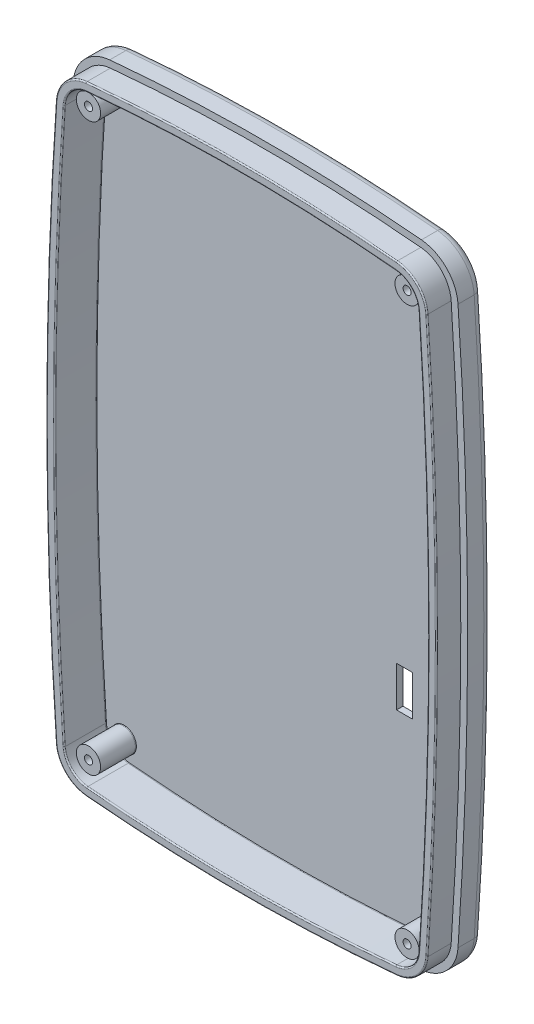
from build123d import *

# Parameters (mm, degrees)
IZIM1_W                           = 50
IZIM1_H                           = 80
Y_KSEKLIK_EKSTR_ZYON1_DEPTH       = 1.5
KES_EKSTR_ZYON1_DEPTH             = 48.265209192
KES_EKSTR_ZYON2_DEPTH             = 48.265209192
RADYUS1_R                         = 5
RADYUS2_R                         = 1
BO_ALTMA1_T                       = -0.7
Y_KSEKLIK_EKSTR_ZYON10_DEPTH      = 3
Y_KSEKLIK_EKSTR_ZYON10_DEPTH_BACK = 2.3
KES_EKSTR_ZYON5_DEPTH             = 3
RADYUS3_R                         = 0.15
Y_KSEKLIK_EKSTR_ZYON18_OUTLINE_W  = 1.361974435
Y_KSEKLIK_EKSTR_ZYON18_OUTLINE_H  = 3.904326714
Y_KSEKLIK_EKSTR_ZYON18_DEPTH      = 0.4
IZIM29_R                          = 1.5
IZIM29_R_2                        = 0.5
Y_KSEKLIK_EKSTR_ZYON19_DEPTH      = 4.5
RADYUS4_R                         = 0.2
Y_KSEKLIK_EKSTR_ZYON20_DEPTH      = 0.1
IZIM31_W                          = 2
IZIM31_H                          = 5
KES_EKSTR_ZYON6_DEPTH             = 10


# Read off the part's stored shape, not the designer's step: Yükseklik-Ekstrüzyon18
with BuildPart() as part:
    # Çizim1 → Yükseklik-Ekstrüzyon1 (new, symmetric)
    with BuildSketch(Plane.XY):
        Rectangle(IZIM1_W, IZIM1_H)
    extrude(amount=Y_KSEKLIK_EKSTR_ZYON1_DEPTH, both=True)

    # Çizim2 → Kes-Ekstrüzyon1 (cut, through all)
    with BuildSketch(Plane.XY.offset(1.5)):
        with BuildLine():
            Line((25, 40), (6.85e-07, 40))
            ThreePointArc((6.85e-07, 40), (12.522480128, 39.624663086), (25, 38.5))
            Line((25, 38.5), (25, 40))
        make_face()
        with BuildLine():
            Line((6.85e-07, 40), (-25, 40))
            Line((-25, 40), (-25, 38.5))
            ThreePointArc((-25, 38.5), (-12.522479444, 39.624663127), (6.85e-07, 40))
        make_face()
        with BuildLine():
            ThreePointArc((6.85e-07, -40), (-12.522479444, -39.624663127), (-25, -38.5))
            Line((-25, -38.5), (-25, -40))
            Line((-25, -40), (6.85e-07, -40))
        make_face()
        with BuildLine():
            Line((25, -40), (25, -38.5))
            ThreePointArc((25, -38.5), (12.522480128, -39.624663086), (6.85e-07, -40))
            Line((6.85e-07, -40), (25, -40))
        make_face()
    extrude(amount=-KES_EKSTR_ZYON1_DEPTH, mode=Mode.SUBTRACT)

    # Çizim3 → Kes-Ekstrüzyon2 (cut, through all)
    with BuildSketch(Plane.XY.offset(1.5)):
        with BuildLine():
            Line((25, 0), (25, 38.5))
            ThreePointArc((25, 38.5), (24.250158144, 38.588932768), (23.5, 38.675156933))
            ThreePointArc((23.5, 38.675156933), (24.624859083, 19.352117221), (25, 0))
        make_face()
        with BuildLine():
            Line((25, -38.5), (25, 0))
            ThreePointArc((25, 0), (24.624859083, -19.352117221), (23.5, -38.675156933))
            ThreePointArc((23.5, -38.675156933), (24.250158144, -38.588932768), (25, -38.5))
        make_face()
        with BuildLine():
            ThreePointArc((-25, -38.5), (-24.250158144, -38.588932768), (-23.5, -38.675156933))
            ThreePointArc((-23.5, -38.675156933), (-24.624859077, -19.352117374), (-25, -3.05e-07))
            Line((-25, -3.05e-07), (-25, -38.5))
        make_face()
        with BuildLine():
            ThreePointArc((-25, -3.05e-07), (-24.624859089, 19.352117069), (-23.5, 38.675156933))
            ThreePointArc((-23.5, 38.675156933), (-24.250158144, 38.588932768), (-25, 38.5))
            Line((-25, 38.5), (-25, -3.05e-07))
        make_face()
    extrude(amount=-KES_EKSTR_ZYON2_DEPTH, mode=Mode.SUBTRACT)

    # Radyus1
    radyus1_edges = [part.edges().sort_by_distance(p)[0] for p in [
        (23.5, 38.675156933, 0),
        (23.5, -38.675156933, 0),
        (-23.5, -38.675156933, 0),
        (-23.5, 38.675156933, 0),
    ]]
    fillet(radyus1_edges, radius=RADYUS1_R)

    # Radyus2
    radyus2_edges = [part.edges().sort_by_distance(p)[0] for p in [
        (-25, 0, -1.5),
        (0, -40, -1.5),
        (0, 40, -1.5),
        (25, 0, -1.5),
        (22.39677245, 37.62453868, -1.5),
        (-22.39677245, 37.62453868, -1.5),
        (22.39677245, -37.62453868, -1.5),
        (-22.39677245, -37.62453868, -1.5),
    ]]
    fillet(radyus2_edges, radius=RADYUS2_R)

    # İç Boşaltma1
    bo_altma1_openings = [part.faces().sort_by_distance(p)[0] for p in [
        (0, 0, 1.5),
    ]]
    offset(amount=BO_ALTMA1_T, openings=bo_altma1_openings)



with BuildPart() as body_2:
    # Çizim10 → Yükseklik-Ekstrüzyon10 (new, two sides: drawn at the far end of the back side and taken through both)
    with BuildSketch(Plane.XY.offset(1.5).offset(-Y_KSEKLIK_EKSTR_ZYON10_DEPTH_BACK)):
        with BuildLine():
            ThreePointArc((-23.11011168, -34.427230729), (-21.896076477, -37.135352066), (-19.216914592, -38.41202518))
            ThreePointArc((-19.216914592, -38.41202518), (0, -39.3), (19.216914592, -38.41202518))
            ThreePointArc((19.216914592, -38.41202518), (21.896076477, -37.135352066), (23.11011168, -34.427230729))
            ThreePointArc((23.11011168, -34.427230729), (24.3, 0), (23.11011168, 34.427230729))
            ThreePointArc((23.11011168, 34.427230729), (21.896076477, 37.135352066), (19.216914592, 38.41202518))
            ThreePointArc((19.216914592, 38.41202518), (0, 39.3), (-19.216914592, 38.41202518))
            ThreePointArc((-19.216914592, 38.41202518), (-21.896076477, 37.135352066), (-23.11011168, 34.427230729))
            ThreePointArc((-23.11011168, 34.427230729), (-24.3, 0), (-23.11011168, -34.427230729))
        make_face()
        with BuildLine():
            ThreePointArc((19.106251723, 37.217138688), (0, 38.1), (-19.106251723, 37.217138688))
            ThreePointArc((-19.106251723, 37.217138688), (-21.037740524, 36.296746443), (-21.912975205, 34.344379898))
            ThreePointArc((-21.912975205, 34.344379898), (-23.1, 0), (-21.912975205, -34.344379898))
            ThreePointArc((-21.912975205, -34.344379898), (-21.037740524, -36.296746443), (-19.106251723, -37.217138688))
            ThreePointArc((-19.106251723, -37.217138688), (0, -38.1), (19.106251723, -37.217138688))
            ThreePointArc((19.106251723, -37.217138688), (21.037740524, -36.296746443), (21.912975205, -34.344379898))
            ThreePointArc((21.912975205, -34.344379898), (23.1, 0), (21.912975205, 34.344379898))
            ThreePointArc((21.912975205, 34.344379898), (21.037740524, 36.296746443), (19.106251723, 37.217138688))
        make_face(mode=Mode.SUBTRACT)
    extrude(amount=Y_KSEKLIK_EKSTR_ZYON10_DEPTH + Y_KSEKLIK_EKSTR_ZYON10_DEPTH_BACK)

    # Çizim13 → Kes-Ekstrüzyon5 (cut)
    with BuildSketch(Plane.XY.offset(4.5)):
        with BuildLine():
            ThreePointArc((-23.11011168, 34.427230729), (-24.3, 0), (-23.11011168, -34.427230729))
            ThreePointArc((-23.11011168, -34.427230729), (-21.896076477, -37.135352066), (-19.216914592, -38.41202518))
            ThreePointArc((-19.216914592, -38.41202518), (0, -39.3), (19.216914592, -38.41202518))
            ThreePointArc((19.216914592, -38.41202518), (21.896076477, -37.135352066), (23.11011168, -34.427230729))
            ThreePointArc((23.11011168, -34.427230729), (24.3, 0), (23.11011168, 34.427230729))
            ThreePointArc((23.11011168, 34.427230729), (21.896076477, 37.135352066), (19.216914592, 38.41202518))
            ThreePointArc((19.216914592, 38.41202518), (0, 39.3), (-19.216914592, 38.41202518))
            ThreePointArc((-19.216914592, 38.41202518), (-21.896076477, 37.135352066), (-23.11011168, 34.427230729))
        make_face()
        with BuildLine():
            ThreePointArc((19.203081733, 38.262664369), (0, 39.15), (-19.203081733, 38.262664369))
            ThreePointArc((-19.203081733, 38.262664369), (-21.788784483, 37.030526363), (-22.960469621, 34.416874375))
            ThreePointArc((-22.960469621, 34.416874375), (-24.15, 0), (-22.960469621, -34.416874375))
            ThreePointArc((-22.960469621, -34.416874375), (-21.788784483, -37.030526363), (-19.203081733, -38.262664369))
            ThreePointArc((-19.203081733, -38.262664369), (0, -39.15), (19.203081733, -38.262664369))
            ThreePointArc((19.203081733, -38.262664369), (21.788784483, -37.030526363), (22.960469621, -34.416874375))
            ThreePointArc((22.960469621, -34.416874375), (24.15, 0), (22.960469621, 34.416874375))
            ThreePointArc((22.960469621, 34.416874375), (21.788784483, 37.030526363), (19.203081733, 38.262664369))
        make_face(mode=Mode.SUBTRACT)
    extrude(amount=-KES_EKSTR_ZYON5_DEPTH, mode=Mode.SUBTRACT)

    # Radyus3
    radyus3_edges = [body_2.edges().sort_by_distance(p)[0] for p in [
        (21.037740524, 36.296746443, 4.5),
        (0, 38.1, 4.5),
        (-21.037740524, 36.296746443, 4.5),
        (-23.1, 0, 4.5),
        (-21.037740524, -36.296746443, 4.5),
        (0, -38.1, 4.5),
        (21.037740524, -36.296746443, 4.5),
        (23.1, 0, 4.5),
        (21.788784483, 37.030526363, 4.5),
        (24.15, 0, 4.5),
        (21.788784483, -37.030526363, 4.5),
        (0, -39.15, 4.5),
        (-21.788784483, -37.030526363, 4.5),
        (-24.15, 0, 4.5),
        (-21.788784483, 37.030526363, 4.5),
        (0, 39.15, 4.5),
    ]]
    fillet(radyus3_edges, radius=RADYUS3_R)


with BuildPart() as body_3:
    # Yükseklik-Ekstrüzyon18 outline → Yükseklik-Ekstrüzyon18 (new body)
    # profile 1 of 9: a face of its own
    with BuildSketch(Plane(origin=(0, 0, -1.5), x_dir=(-1, 0, 0), z_dir=(0, 0, -1))):
        with BuildLine():
            add(Edge.make_bspline(
                [(-13.379633695, 28.325841774), (-13.379113621, 28.357294053), (-13.378108017, 28.418109479), (-13.373559601, 28.506457912), (-13.364214937, 28.588831935), (-13.351604714, 28.665588942), (-13.33551852, 28.736508554), (-13.31565116, 28.801502836), (-13.292302743, 28.860643344), (-13.265304756, 28.91451003), (-13.233610171, 28.963460072), (-13.197432976, 29.008128563), (-13.156542325, 29.049029366), (-13.111215671, 29.085631404), (-13.061498816, 29.118897521), (-13.007019082, 29.147751835), (-12.947739844, 29.172368264), (-12.882797572, 29.194618778), (-12.80744064, 29.212208682), (-12.7185974, 29.227455164), (-12.614705136, 29.240772603), (-12.495647744, 29.250969749), (-12.361558556, 29.259611002), (-12.212056829, 29.264798221), (-12.047470329, 29.268434129), (-11.932774661, 29.268998461), (-11.872949476, 29.269292815)],
                knots=[0, 0, 0, 0, 0.044817452, 0.086658029, 0.125981634, 0.162867368, 0.197435717, 0.229510888, 0.259601573, 0.287926191, 0.31521201, 0.342518618, 0.369675189, 0.397455655, 0.425392964, 0.454781463, 0.485127541, 0.516768088, 0.552474999, 0.595233194, 0.645167624, 0.701654348, 0.76545432, 0.836588685, 0.914764765, 1, 1, 1, 1], degree=3))
            Line((-13.379633695, 28.325841774), (-13.379633695, 27.971160932))
            add(Edge.make_bspline(
                [(-12.650409883, 27.158232441), (-12.682626873, 27.162338681), (-12.744751035, 27.170256763), (-12.833921482, 27.187997413), (-12.915641102, 27.210357505), (-12.990150798, 27.238238409), (-13.057485194, 27.270573128), (-13.117829341, 27.307660027), (-13.170839721, 27.349468801), (-13.216041073, 27.397055724), (-13.254743653, 27.449688866), (-13.288172795, 27.507535272), (-13.316672028, 27.5712348), (-13.339788366, 27.640397025), (-13.357583218, 27.715200135), (-13.370068547, 27.795371468), (-13.377980908, 27.881388071), (-13.37907179, 27.940640479), (-13.379633695, 27.971160932)],
                knots=[0, 0, 0, 0, 0.078791164, 0.151933343, 0.220424327, 0.284154632, 0.344717064, 0.401401799, 0.455704634, 0.508056641, 0.560156499, 0.61388949, 0.669875884, 0.729208158, 0.790580573, 0.856234513, 0.92594752, 1, 1, 1, 1], degree=3))
            add(Edge.make_bspline(
                [(-13.288835399, 26.492141818), (-13.288532126, 26.519352767), (-13.287948169, 26.571747909), (-13.280560776, 26.647328483), (-13.269489696, 26.716824081), (-13.254123918, 26.780601122), (-13.233469984, 26.838300623), (-13.208619618, 26.890416832), (-13.179766499, 26.93716904), (-13.144706019, 26.977656636), (-13.104654579, 27.013429178), (-13.05820243, 27.044960092), (-13.005661265, 27.073184143), (-12.946775974, 27.097922883), (-12.881630338, 27.118397178), (-12.810191511, 27.135103843), (-12.732624857, 27.149636209), (-12.678365721, 27.155309434), (-12.650409883, 27.158232441)],
                knots=[0, 0, 0, 0, 0.07741527, 0.149064411, 0.21588642, 0.277581414, 0.335478354, 0.389958001, 0.441674342, 0.491308484, 0.541828859, 0.594093953, 0.650701584, 0.71131916, 0.775591795, 0.844797483, 0.920035281, 1, 1, 1, 1], degree=3))
            add(Edge.make_bspline(
                [(-11.678584374, 25.364966101), (-11.726113288, 25.365289219), (-11.818110626, 25.36591465), (-11.952222372, 25.369281386), (-12.077801603, 25.375696221), (-12.195344809, 25.384218054), (-12.304230861, 25.394435592), (-12.4050294, 25.407979476), (-12.497323087, 25.424092061), (-12.582385914, 25.442629481), (-12.661441073, 25.464222172), (-12.735143121, 25.492322399), (-12.805256109, 25.524190598), (-12.871414524, 25.561257093), (-12.933962603, 25.603032548), (-12.992393168, 25.650004608), (-13.046431712, 25.702270707), (-13.097283494, 25.759021816), (-13.14353865, 25.822604996), (-13.182114644, 25.894994269), (-13.215692316, 25.974687649), (-13.24231621, 26.062745024), (-13.263628536, 26.158515777), (-13.278004371, 26.262669021), (-13.287553283, 26.374681673), (-13.28839898, 26.452159576), (-13.288835399, 26.492141818)],
                knots=[0, 0, 0, 0, 0.062134535, 0.120268091, 0.175360268, 0.226498412, 0.274326899, 0.318305581, 0.359418605, 0.396768718, 0.432095471, 0.466429145, 0.499763088, 0.532699085, 0.565448887, 0.597986476, 0.630560753, 0.663624152, 0.697509623, 0.733058817, 0.770604125, 0.810397984, 0.853146026, 0.898740793, 0.947745486, 1, 1, 1, 1], degree=3))
            Line((-11.678584374, 25.364966101), (-10.428689085, 25.364966101))
            Line((-10.428689085, 25.364966101), (-10.428689085, 29.269292815))
            Line((-10.428689085, 29.269292815), (-11.872949476, 29.269292815))
        make_face()
        with BuildLine():
            add(Edge.make_bspline(
                [(-12.01765926, 26.414821395), (-12.017293, 26.388792369), (-12.016622688, 26.341155226), (-12.011008733, 26.276473463), (-12.003129217, 26.2248934), (-11.989152706, 26.185992356), (-11.972406991, 26.157087655), (-11.953421608, 26.13551377), (-11.933412927, 26.118043636), (-11.900963831, 26.103772683), (-11.852762272, 26.095512718), (-11.812672143, 26.092826915), (-11.79066352, 26.091352466)],
                knots=[0, 0, 0, 0, 0.167617016, 0.306765069, 0.418210582, 0.50254002, 0.57150695, 0.631977243, 0.687171809, 0.741004388, 0.857816951, 1, 1, 1, 1], degree=3))
            add(Edge.make_bspline(
                [(-11.810525648, 26.861009895), (-11.831371785, 26.860459557), (-11.86914921, 26.859462234), (-11.91984959, 26.849670488), (-11.958193684, 26.831986527), (-11.982146881, 26.809434674), (-11.991952108, 26.783404352), (-11.998814517, 26.756073658), (-12.004936922, 26.720248587), (-12.009810416, 26.675728292), (-12.012935245, 26.622689045), (-12.016001975, 26.560981803), (-12.017077762, 26.490725914), (-12.017458191, 26.441067429), (-12.01765926, 26.414821395)],
                knots=[0, 0, 0, 0, 0.107580107, 0.19495695, 0.264280627, 0.323837119, 0.358294207, 0.406253532, 0.469462515, 0.545616321, 0.637359468, 0.743657985, 0.864515375, 1, 1, 1, 1], degree=3))
            add(Edge.make_bspline(
                [(-11.790663521, 26.860899551), (-11.791834722, 26.861132427), (-11.79887429, 26.863125038), (-11.80524155, 26.86196915), (-11.810525648, 26.861009895)],
                knots=[0.403311423, 0.403311423, 0.403311423, 0.403311423, 0.504816703, 1, 1, 1, 1], degree=3))
            Line((-11.790663521, 26.860899551), (-11.79066352, 26.091352466))
        make_face(mode=Mode.SUBTRACT)
        with BuildLine():
            add(Edge.make_bspline(
                [(-12.01765926, 27.861919232), (-12.01754015, 27.843710312), (-12.017315759, 27.809406503), (-12.015230326, 27.760895627), (-12.011749359, 27.718299238), (-12.007149622, 27.681510977), (-12.000508258, 27.650816296), (-11.994044628, 27.62548396), (-11.984944173, 27.605937386), (-11.97006343, 27.586629193), (-11.942387901, 27.570914539), (-11.9021108, 27.556886415), (-11.850034382, 27.548524732), (-11.811726215, 27.545685998), (-11.79066352, 27.544125197)],
                knots=[0, 0, 0, 0, 0.116332655, 0.219159248, 0.310114608, 0.389378867, 0.455745983, 0.510735795, 0.556006, 0.592575844, 0.664646823, 0.754478689, 0.865006843, 1, 1, 1, 1], degree=3))
            Line((-12.01765926, 27.861919232), (-12.01765926, 28.225112415))
            add(Edge.make_bspline(
                [(-11.79066352, 28.54290645), (-11.809854909, 28.541428162), (-11.845695354, 28.53866742), (-11.895029528, 28.528802979), (-11.935105869, 28.512181785), (-11.962834745, 28.494137808), (-11.980167998, 28.474351989), (-11.98945248, 28.453479786), (-11.998761897, 28.428501845), (-12.005603513, 28.397702462), (-12.011267103, 28.362188506), (-12.014245648, 28.321136795), (-12.017605875, 28.275056362), (-12.0176408, 28.242382037), (-12.01765926, 28.225112415)],
                knots=[0, 0, 0, 0, 0.125216394, 0.233845045, 0.325557213, 0.406216731, 0.446597804, 0.494757229, 0.55363984, 0.620058668, 0.699476286, 0.787501601, 0.887686528, 1, 1, 1, 1], degree=3))
            Line((-11.79066352, 28.54290645), (-11.79066352, 27.544125197))
        make_face(mode=Mode.SUBTRACT)
    # profile 2 of 9: a face of its own
    with BuildSketch(Plane(origin=(0, 0, -1.5), x_dir=(-1, 0, 0), z_dir=(0, 0, -1))):
        with BuildLine():
            add(Edge.make_bspline(
                [(-8.243996791, 25.274167805), (-8.306943623, 25.275591943), (-8.429848922, 25.278372609), (-8.609789454, 25.298283059), (-8.780425899, 25.332301823), (-8.941216019, 25.379244964), (-9.089947168, 25.439539364), (-9.223372454, 25.51450511), (-9.342195385, 25.601314497), (-9.443287808, 25.701346938), (-9.526530594, 25.80941474), (-9.592718136, 25.921821938), (-9.638528597, 26.038712995), (-9.661681088, 26.140843614), (-9.670976848, 26.228900567), (-9.678435235, 26.305713569), (-9.683568225, 26.393513898), (-9.688814861, 26.49186184), (-9.691963266, 26.600900726), (-9.695073768, 26.720776563), (-9.696174407, 26.851550152), (-9.69656639, 26.942350177), (-9.696769522, 26.98940436)],
                knots=[0, 0, 0, 0, 0.071146722, 0.138915794, 0.204333376, 0.26759355, 0.327999437, 0.385320887, 0.440168034, 0.493844102, 0.545487287, 0.5939896, 0.640794149, 0.686831541, 0.711861859, 0.740851584, 0.774063217, 0.811262227, 0.852177909, 0.897360892, 0.946810594, 1, 1, 1, 1], degree=3))
            add(Edge.make_bspline(
                [(-6.836623208, 26.98940436), (-6.836824117, 26.942586516), (-6.837211738, 26.852259166), (-6.838341415, 26.72219639), (-6.841365374, 26.60255227), (-6.844857387, 26.493541855), (-6.848868439, 26.394908543), (-6.85439529, 26.306672277), (-6.861603752, 26.22912402), (-6.871260811, 26.13982079), (-6.892435092, 26.036516605), (-6.936296148, 25.918766601), (-6.999221131, 25.8063229), (-7.079314125, 25.699661641), (-7.175492441, 25.601156144), (-7.287847886, 25.514188047), (-7.415536903, 25.440784665), (-7.557412978, 25.379720309), (-7.71241564, 25.332711991), (-7.879374319, 25.298916284), (-8.057856737, 25.278111151), (-8.180805622, 25.2755065), (-8.243996791, 25.274167805)],
                knots=[0, 0, 0, 0, 0.053616563, 0.103444364, 0.148949518, 0.190672732, 0.228347212, 0.261994641, 0.291904073, 0.317531767, 0.364851406, 0.412232989, 0.460837607, 0.511908114, 0.564567014, 0.618027444, 0.674085641, 0.732789049, 0.794545765, 0.859229357, 0.927649107, 1, 1, 1, 1], degree=3))
            Line((-6.836623208, 26.98940436), (-6.836623208, 27.644854557))
            add(Edge.make_bspline(
                [(-8.243996791, 29.360091111), (-8.183417287, 29.358890092), (-8.064781383, 29.356538074), (-7.891704575, 29.337458282), (-7.72800417, 29.304605637), (-7.574359207, 29.259784363), (-7.431489256, 29.202112201), (-7.302611297, 29.129816943), (-7.188080245, 29.043635177), (-7.08945098, 28.945262328), (-7.006107222, 28.838779238), (-6.941767964, 28.725799916), (-6.895219022, 28.608664341), (-6.872490294, 28.505684069), (-6.86303384, 28.416480765), (-6.855937415, 28.338675481), (-6.849523681, 28.250003679), (-6.844640798, 28.150430645), (-6.841409329, 28.039743941), (-6.838335074, 27.917974048), (-6.837209689, 27.785073494), (-6.836823974, 27.692854624), (-6.836623208, 27.644854557)],
                knots=[0, 0, 0, 0, 0.069367509, 0.135845898, 0.199097737, 0.2603637, 0.318899009, 0.37516083, 0.429104342, 0.482528773, 0.534257864, 0.583498721, 0.630919578, 0.678091582, 0.703720437, 0.733631223, 0.76756879, 0.805528085, 0.847794505, 0.894384619, 0.945027028, 1, 1, 1, 1], degree=3))
            add(Edge.make_bspline(
                [(-9.696769522, 27.644854557), (-9.696605839, 27.69096397), (-9.696290216, 27.779874428), (-9.694665113, 27.908028359), (-9.69328369, 28.025825773), (-9.688213739, 28.13312998), (-9.684657597, 28.230374695), (-9.678730247, 28.317375732), (-9.672684201, 28.394061687), (-9.662670181, 28.482357619), (-9.641919812, 28.585163666), (-9.596656931, 28.702349885), (-9.533521196, 28.815212017), (-9.452384847, 28.922737931), (-9.354644232, 29.023354817), (-9.238721988, 29.111109292), (-9.107173717, 29.187007462), (-8.960139494, 29.249637857), (-8.798577259, 29.298844674), (-8.624586896, 29.33487375), (-8.438188382, 29.356299611), (-8.310025017, 29.358801941), (-8.243996791, 29.360091111)],
                knots=[0, 0, 0, 0, 0.052106332, 0.100474013, 0.144837858, 0.185218173, 0.221860821, 0.254796903, 0.283755445, 0.308779056, 0.355211857, 0.401811202, 0.450136793, 0.500906398, 0.553625073, 0.608138215, 0.664648221, 0.72485616, 0.788330962, 0.855200376, 0.925400973, 1, 1, 1, 1], degree=3))
            Line((-9.696769522, 27.644854557), (-9.696769522, 26.98940436))
        make_face()
        with BuildLine():
            add(Edge.make_bspline(
                [(-8.334795087, 26.375806502), (-8.33494702, 26.354996704), (-8.335233665, 26.315735796), (-8.333334497, 26.259943048), (-8.33219211, 26.210512278), (-8.330292399, 26.167439682), (-8.326991477, 26.130851405), (-8.32505873, 26.100623997), (-8.320314862, 26.076840193), (-8.315512269, 26.05422624), (-8.306009581, 26.032815627), (-8.290106802, 26.014396144), (-8.270405099, 26.002339723), (-8.255747108, 26.001158229), (-8.248252961, 26.000554171)],
                knots=[0, 0, 0, 0, 0.150704583, 0.284327549, 0.404255114, 0.50884705, 0.59645543, 0.670413097, 0.72785384, 0.771883417, 0.837788865, 0.894819677, 0.946224774, 1, 1, 1, 1], degree=3))
            Line((-8.334795087, 26.375806502), (-8.334795087, 28.15559497))
            add(Edge.make_bspline(
                [(-8.241868706, 28.633704746), (-8.250370666, 28.63301492), (-8.267173307, 28.631651601), (-8.289111653, 28.616299837), (-8.305684636, 28.592813708), (-8.315601846, 28.566524757), (-8.320364107, 28.538252885), (-8.325028253, 28.50829288), (-8.327048099, 28.469836797), (-8.330264073, 28.423062487), (-8.332192463, 28.367940987), (-8.333349665, 28.304561975), (-8.335228022, 28.232924156), (-8.334944686, 28.18231567), (-8.334795087, 28.15559497)],
                knots=[0, 0, 0, 0, 0.0485567, 0.095963852, 0.14874572, 0.213245262, 0.256420944, 0.314434285, 0.388475512, 0.478888683, 0.585623771, 0.707351988, 0.845485206, 1, 1, 1, 1], degree=3))
            add(Edge.make_bspline(
                [(-8.198597643, 28.183969437), (-8.198539878, 28.21068902), (-8.19843048, 28.261291879), (-8.199153289, 28.332703834), (-8.200385432, 28.395142558), (-8.202772567, 28.448561655), (-8.204560349, 28.493297578), (-8.207354891, 28.529243113), (-8.210394278, 28.556615152), (-8.216058055, 28.57996113), (-8.222001268, 28.600482664), (-8.229947788, 28.61713288), (-8.234088047, 28.629770065), (-8.239822239, 28.632669847), (-8.241868706, 28.633704746)],
                knots=[0, 0, 0, 0, 0.175072095, 0.331560133, 0.467934671, 0.584225886, 0.681943054, 0.76120055, 0.820581807, 0.861922569, 0.918763478, 0.959045553, 0.985383833, 1, 1, 1, 1], degree=3))
            Line((-8.198597643, 28.183969437), (-8.198597643, 26.375806502))
            add(Edge.make_bspline(
                [(-8.248252961, 26.000554171), (-8.247260439, 26.001220272), (-8.243679734, 26.003623352), (-8.239950507, 26.012309209), (-8.231505976, 26.024010819), (-8.222201148, 26.037856457), (-8.214954301, 26.055849545), (-8.211746239, 26.078324412), (-8.207106679, 26.108247904), (-8.203756113, 26.146154935), (-8.202129986, 26.192315107), (-8.199496578, 26.246204887), (-8.199403388, 26.308420302), (-8.198877532, 26.352398772), (-8.198597643, 26.375806502)],
                knots=[0, 0, 0, 0, 0.009199604, 0.033189236, 0.070444793, 0.122518127, 0.162151234, 0.220247298, 0.298308526, 0.398089248, 0.515973477, 0.657754866, 0.817838549, 1, 1, 1, 1], degree=3))
        make_face(mode=Mode.SUBTRACT)
    # profile 3 of 9: a face of its own
    with BuildSketch(Plane(origin=(0, 0, -1.5), x_dir=(-1, 0, 0), z_dir=(0, 0, -1))):
        with BuildLine():
            add(Edge.make_bspline(
                [(-3.85886455, 25.364966101), (-3.871825185, 25.432600496), (-3.89825243, 25.570509693), (-3.939542204, 25.781398664), (-3.9826904, 26.000379822), (-4.012515567, 26.14905597), (-4.027692631, 26.224712463)],
                knots=[0, 0, 0, 0, 0.235793302, 0.480791839, 0.735791724, 1, 1, 1, 1], degree=3))
            Line((-3.85886455, 25.364966101), (-2.200376931, 25.364966101))
            Line((-2.200376931, 25.364966101), (-2.200376931, 29.269292815))
            Line((-2.200376931, 29.269292815), (-3.37862669, 29.269292815))
            Line((-3.37862669, 29.269292815), (-3.394232647, 26.740418408))
            Line((-3.394232647, 26.740418408), (-3.658824555, 29.269292815))
            Line((-3.658824555, 29.269292815), (-4.59943815, 29.269292815))
            Line((-4.59943815, 29.269292815), (-4.864030058, 26.69501926))
            Line((-4.864030058, 26.69501926), (-4.879636015, 29.269292815))
            Line((-4.879636015, 29.269292815), (-6.059304497, 29.269292815))
            Line((-6.059304497, 29.269292815), (-6.059304497, 25.364966101))
            Line((-6.059304497, 25.364966101), (-4.397270069, 25.364966101))
            Line((-4.397270069, 25.364966101), (-4.146156033, 27.14546393))
            Line((-4.146156033, 27.14546393), (-4.027692631, 26.224712463))
        make_face()
    # profile 4 of 9: a face of its own
    with BuildSketch(Plane(origin=(0, 0, -1.5), x_dir=(-1, 0, 0), z_dir=(0, 0, -1))):
        with BuildLine():
            add(Edge.make_bspline(
                [(-0.015684637, 25.274167805), (-0.078631469, 25.275591943), (-0.201536768, 25.278372609), (-0.3814773, 25.298283059), (-0.552113744, 25.332301823), (-0.712903864, 25.379244964), (-0.861635014, 25.439539364), (-0.995060299, 25.51450511), (-1.113883231, 25.601314497), (-1.214975653, 25.701346938), (-1.298218439, 25.80941474), (-1.364405982, 25.921821938), (-1.410216443, 26.038712995), (-1.433368934, 26.140843614), (-1.442664694, 26.228900567), (-1.450123081, 26.305713569), (-1.455256071, 26.393513898), (-1.460502707, 26.49186184), (-1.463651112, 26.600900726), (-1.466761613, 26.720776563), (-1.467862252, 26.851550152), (-1.468254235, 26.942350177), (-1.468457368, 26.98940436)],
                knots=[0, 0, 0, 0, 0.071146722, 0.138915794, 0.204333376, 0.26759355, 0.327999437, 0.385320887, 0.440168034, 0.493844102, 0.545487287, 0.5939896, 0.640794149, 0.686831541, 0.711861859, 0.740851584, 0.774063217, 0.811262227, 0.852177909, 0.897360892, 0.946810594, 1, 1, 1, 1], degree=3))
            add(Edge.make_bspline(
                [(1.391688946, 26.98940436), (1.391488037, 26.942586516), (1.391100417, 26.852259166), (1.389970739, 26.72219639), (1.38694678, 26.60255227), (1.383454767, 26.493541855), (1.379443715, 26.394908543), (1.373916865, 26.306672277), (1.366708402, 26.22912402), (1.357051343, 26.13982079), (1.335877062, 26.036516605), (1.292016006, 25.918766601), (1.229091024, 25.8063229), (1.148998029, 25.699661641), (1.052819713, 25.601156144), (0.940464269, 25.514188047), (0.812775252, 25.440784665), (0.670899176, 25.379720309), (0.515896514, 25.332711991), (0.348937835, 25.298916284), (0.170455418, 25.278111151), (0.047506533, 25.2755065), (-0.015684637, 25.274167805)],
                knots=[0, 0, 0, 0, 0.053616563, 0.103444364, 0.148949518, 0.190672732, 0.228347212, 0.261994641, 0.291904073, 0.317531767, 0.364851406, 0.412232989, 0.460837607, 0.511908114, 0.564567014, 0.618027444, 0.674085641, 0.732789049, 0.794545765, 0.859229357, 0.927649107, 1, 1, 1, 1], degree=3))
            Line((1.391688946, 26.98940436), (1.391688946, 27.644854557))
            add(Edge.make_bspline(
                [(-0.015684637, 29.360091111), (0.044894867, 29.358890092), (0.163530772, 29.356538074), (0.336607579, 29.337458282), (0.500307984, 29.304605637), (0.653952947, 29.259784363), (0.796822898, 29.202112201), (0.925700857, 29.129816943), (1.04023191, 29.043635177), (1.138861174, 28.945262328), (1.222204932, 28.838779238), (1.286544191, 28.725799916), (1.333093133, 28.608664341), (1.35582186, 28.505684069), (1.365278315, 28.416480765), (1.37237474, 28.338675481), (1.378788473, 28.250003679), (1.383671357, 28.150430645), (1.386902825, 28.039743941), (1.38997708, 27.917974048), (1.391102466, 27.785073494), (1.391488181, 27.692854624), (1.391688946, 27.644854557)],
                knots=[0, 0, 0, 0, 0.069367509, 0.135845898, 0.199097737, 0.2603637, 0.318899009, 0.37516083, 0.429104342, 0.482528773, 0.534257864, 0.583498721, 0.630919578, 0.678091582, 0.703720437, 0.733631223, 0.76756879, 0.805528085, 0.847794505, 0.894384619, 0.945027028, 1, 1, 1, 1], degree=3))
            add(Edge.make_bspline(
                [(-1.468457368, 27.644854557), (-1.468293684, 27.69096397), (-1.467978061, 27.779874428), (-1.466352958, 27.908028359), (-1.464971536, 28.025825773), (-1.459901584, 28.13312998), (-1.456345442, 28.230374695), (-1.450418093, 28.317375732), (-1.444372047, 28.394061687), (-1.434358027, 28.482357619), (-1.413607658, 28.585163666), (-1.368344776, 28.702349885), (-1.305209042, 28.815212017), (-1.224072693, 28.922737931), (-1.126332078, 29.023354817), (-1.010409833, 29.111109292), (-0.878861563, 29.187007462), (-0.731827339, 29.249637857), (-0.570265104, 29.298844674), (-0.396274741, 29.33487375), (-0.209876227, 29.356299611), (-0.081712863, 29.358801941), (-0.015684637, 29.360091111)],
                knots=[0, 0, 0, 0, 0.052106332, 0.100474013, 0.144837858, 0.185218173, 0.221860821, 0.254796903, 0.283755445, 0.308779056, 0.355211857, 0.401811202, 0.450136793, 0.500906398, 0.553625073, 0.608138215, 0.664648221, 0.72485616, 0.788330962, 0.855200376, 0.925400973, 1, 1, 1, 1], degree=3))
            Line((-1.468457368, 27.644854557), (-1.468457368, 26.98940436))
        make_face()
        with BuildLine():
            add(Edge.make_bspline(
                [(-0.106482933, 26.375806502), (-0.106634865, 26.354996704), (-0.10692151, 26.315735796), (-0.105022342, 26.259943048), (-0.103879956, 26.210512278), (-0.101980244, 26.167439682), (-0.098679323, 26.130851405), (-0.096746576, 26.100623997), (-0.092002708, 26.076840193), (-0.087200115, 26.05422624), (-0.077697426, 26.032815627), (-0.061794648, 26.014396144), (-0.042092944, 26.002339723), (-0.027434954, 26.001158229), (-0.019940807, 26.000554171)],
                knots=[0, 0, 0, 0, 0.150704583, 0.284327549, 0.404255114, 0.50884705, 0.59645543, 0.670413097, 0.72785384, 0.771883417, 0.837788865, 0.894819677, 0.946224774, 1, 1, 1, 1], degree=3))
            Line((-0.106482933, 26.375806502), (-0.106482933, 28.15559497))
            add(Edge.make_bspline(
                [(-0.013556552, 28.633704746), (-0.022058512, 28.63301492), (-0.038861153, 28.631651601), (-0.060799498, 28.616299837), (-0.077372481, 28.592813708), (-0.087289692, 28.566524757), (-0.092051952, 28.538252885), (-0.096716099, 28.50829288), (-0.098735945, 28.469836797), (-0.101951919, 28.423062487), (-0.103880309, 28.367940987), (-0.105037511, 28.304561975), (-0.106915868, 28.232924156), (-0.106632531, 28.18231567), (-0.106482933, 28.15559497)],
                knots=[0, 0, 0, 0, 0.0485567, 0.095963852, 0.14874572, 0.213245262, 0.256420944, 0.314434285, 0.388475512, 0.478888683, 0.585623771, 0.707351988, 0.845485206, 1, 1, 1, 1], degree=3))
            add(Edge.make_bspline(
                [(0.029714511, 28.183969437), (0.029772276, 28.21068902), (0.029881675, 28.261291879), (0.029158865, 28.332703834), (0.027926723, 28.395142558), (0.025539587, 28.448561655), (0.023751806, 28.493297578), (0.020957264, 28.529243113), (0.017917876, 28.556615152), (0.012254099, 28.57996113), (0.006310886, 28.600482664), (-0.001635634, 28.61713288), (-0.005775892, 28.629770065), (-0.011510085, 28.632669847), (-0.013556552, 28.633704746)],
                knots=[0, 0, 0, 0, 0.175072095, 0.331560133, 0.467934671, 0.584225886, 0.681943054, 0.76120055, 0.820581807, 0.861922569, 0.918763478, 0.959045553, 0.985383833, 1, 1, 1, 1], degree=3))
            Line((0.029714511, 28.183969437), (0.029714511, 26.375806502))
            add(Edge.make_bspline(
                [(-0.019940807, 26.000554171), (-0.018948285, 26.001220272), (-0.01536758, 26.003623352), (-0.011638353, 26.012309209), (-0.003193822, 26.024010819), (0.006111006, 26.037856457), (0.013357853, 26.055849545), (0.016565916, 26.078324412), (0.021205475, 26.108247904), (0.024556041, 26.146154935), (0.026182168, 26.192315107), (0.028815577, 26.246204887), (0.028908766, 26.308420302), (0.029434622, 26.352398772), (0.029714511, 26.375806502)],
                knots=[0, 0, 0, 0, 0.009199604, 0.033189236, 0.070444793, 0.122518127, 0.162151234, 0.220247298, 0.298308526, 0.398089248, 0.515973477, 0.657754866, 0.817838549, 1, 1, 1, 1], degree=3))
        make_face(mode=Mode.SUBTRACT)
    # profile 5 of 9: a face of its own
    with BuildSketch(Plane(origin=(0, 0, -1.5), x_dir=(-1, 0, 0), z_dir=(0, 0, -1))):
        with BuildLine():
            add(Edge.make_bspline(
                [(5.488678647, 27.952717528), (5.488770376, 27.92954171), (5.488943582, 27.885780284), (5.491391249, 27.823600271), (5.49375362, 27.76891765), (5.498104995, 27.721361931), (5.503315027, 27.681246625), (5.510572886, 27.648382266), (5.517787773, 27.622401354), (5.529807522, 27.597463982), (5.551847166, 27.574899136), (5.585227144, 27.557326902), (5.62527459, 27.54544813), (5.654570394, 27.544586889), (5.670275238, 27.544125197)],
                knots=[0, 0, 0, 0, 0.135134446, 0.255165793, 0.362857509, 0.45423696, 0.533601792, 0.598510394, 0.650414571, 0.690496234, 0.758773734, 0.829754441, 0.908735053, 1, 1, 1, 1], degree=3))
            Line((5.488678647, 27.952717528), (5.488678647, 29.269292815))
            Line((5.488678647, 29.269292815), (4.217502507, 29.269292815))
            Line((4.217502507, 29.269292815), (4.217502507, 28.215890713))
            add(Edge.make_bspline(
                [(4.880755683, 27.249740098), (4.854482169, 27.251574929), (4.80368503, 27.255122385), (4.730702304, 27.265003231), (4.663629168, 27.278443827), (4.602244354, 27.295168851), (4.546873525, 27.316347594), (4.497466615, 27.34135169), (4.453711561, 27.36940445), (4.405883351, 27.411866133), (4.356720578, 27.466019729), (4.30780135, 27.529068065), (4.271341579, 27.588413878), (4.249679494, 27.638596871), (4.240678646, 27.683679762), (4.234464134, 27.727246226), (4.228828353, 27.781665358), (4.224993142, 27.847229766), (4.221221111, 27.923834497), (4.219502475, 28.011589415), (4.217990388, 28.110190682), (4.217670587, 28.179475976), (4.217502507, 28.215890713)],
                knots=[0, 0, 0, 0, 0.057735093, 0.111624871, 0.161343266, 0.207632251, 0.250958004, 0.2910689, 0.328886211, 0.364537781, 0.430939929, 0.489006922, 0.539241606, 0.583430367, 0.607835371, 0.639802237, 0.679936579, 0.727733891, 0.783784803, 0.84808951, 0.920159383, 1, 1, 1, 1], degree=3))
            add(Edge.make_bspline(
                [(4.217502507, 26.448870756), (4.21782852, 26.4848232), (4.218455514, 26.55396764), (4.225491718, 26.653464534), (4.237476358, 26.744167632), (4.253348807, 26.826364876), (4.274667908, 26.899669756), (4.299906997, 26.964827392), (4.330122636, 27.021500559), (4.366622509, 27.069492587), (4.408348832, 27.110734968), (4.456878639, 27.14543321), (4.51095595, 27.176561869), (4.572672143, 27.200637684), (4.640079547, 27.221648578), (4.714554618, 27.236042386), (4.795382277, 27.246068945), (4.851640694, 27.248488121), (4.880755683, 27.249740098)],
                knots=[0, 0, 0, 0, 0.089184998, 0.171522325, 0.247270212, 0.316068583, 0.379002164, 0.436410953, 0.489174977, 0.537748439, 0.58545333, 0.634147084, 0.685372273, 0.739840404, 0.798108953, 0.860349726, 0.927727859, 1, 1, 1, 1], degree=3))
            add(Edge.make_bspline(
                [(6.137744589, 25.364966101), (6.06917202, 25.365040661), (5.937458686, 25.365183876), (5.748041375, 25.367966964), (5.574948628, 25.372958714), (5.418408674, 25.379356023), (5.278324253, 25.386483866), (5.154893215, 25.397332262), (5.04796903, 25.40920955), (4.955143548, 25.422152046), (4.872964302, 25.440504846), (4.796281247, 25.462849961), (4.724186857, 25.49229968), (4.655194494, 25.526196901), (4.590884171, 25.567115975), (4.529436567, 25.61230072), (4.472603854, 25.663775189), (4.419453231, 25.720691597), (4.371935926, 25.784930626), (4.329387759, 25.856285901), (4.295008552, 25.936387426), (4.267060611, 26.023939159), (4.243788529, 26.118869821), (4.229192954, 26.221995982), (4.218551311, 26.332786094), (4.217859533, 26.409354147), (4.217502507, 26.448870756)],
                knots=[0, 0, 0, 0, 0.079724987, 0.153134758, 0.220240913, 0.281046849, 0.335288897, 0.383301021, 0.425075, 0.460377398, 0.49219365, 0.522896546, 0.553118129, 0.582624793, 0.612144262, 0.641615046, 0.67120356, 0.701162674, 0.732008009, 0.763927425, 0.797535361, 0.833092668, 0.8706994, 0.911017865, 0.954076509, 1, 1, 1, 1], degree=3))
            Line((6.137744589, 25.364966101), (7.032249674, 25.364966101))
            Line((7.032249674, 25.364966101), (7.032249674, 29.269292815))
            Line((7.032249674, 29.269292815), (5.670275238, 29.269292815))
            Line((5.670275238, 29.269292815), (5.670275238, 27.544125197))
        make_face()
        with BuildLine():
            add(Edge.make_bspline(
                [(5.488678647, 26.34530395), (5.489246265, 26.320425501), (5.490268395, 26.275626008), (5.499797988, 26.21532217), (5.515277178, 26.168559991), (5.540464981, 26.135945687), (5.57032797, 26.116358654), (5.601297149, 26.101588832), (5.63505631, 26.092931983), (5.658405283, 26.091884816), (5.670275238, 26.091352466)],
                knots=[0, 0, 0, 0, 0.207755591, 0.374112754, 0.509202691, 0.614768302, 0.711267723, 0.804995066, 0.900865026, 1, 1, 1, 1], degree=3))
            Line((5.488678647, 26.34530395), (5.488678647, 26.558821817))
            add(Edge.make_bspline(
                [(5.670275238, 26.86313798), (5.647416276, 26.861287634), (5.603017593, 26.857693731), (5.55481803, 26.837957316), (5.528866136, 26.814511773), (5.517951417, 26.795435192), (5.508943339, 26.77068523), (5.501157818, 26.740042986), (5.495993423, 26.703170033), (5.491767931, 26.660337856), (5.488833939, 26.611590298), (5.488732242, 26.577033339), (5.488678647, 26.558821817)],
                knots=[0, 0, 0, 0, 0.166092219, 0.322598885, 0.365047389, 0.417388159, 0.479796133, 0.555892735, 0.646094533, 0.749476332, 0.867973991, 1, 1, 1, 1], degree=3))
            Line((5.670275238, 26.86313798), (5.670275238, 26.091352466))
        make_face(mode=Mode.SUBTRACT)
    # profile 6 of 9: a face of its own
    with BuildSketch(Plane(origin=(0, 0, -1.5), x_dir=(-1, 0, 0), z_dir=(0, 0, -1))):
        Polygon((-17.522022544, 28.406709006), (-17.522022544, 25.364966101), (-16.160048108, 25.364966101), (-16.160048108, 29.269292815), (-18.203009761, 29.269292815), (-18.203009761, 28.406709006), align=None)
    # profile 7 of 9: a face of its own
    with BuildSketch(Plane(origin=(0, 0, -1.5), x_dir=(-1, 0, 0), z_dir=(0, 0, -1))):
        with Locations((-14.747141328, 27.317129458)):
            Rectangle(Y_KSEKLIK_EKSTR_ZYON18_OUTLINE_W, Y_KSEKLIK_EKSTR_ZYON18_OUTLINE_H)
    # profile 8 of 9: a face of its own
    with BuildSketch(Plane(origin=(0, 0, -1.5), x_dir=(-1, 0, 0), z_dir=(0, 0, -1))):
        with Locations((2.804595727, 27.317129458)):
            Rectangle(Y_KSEKLIK_EKSTR_ZYON18_OUTLINE_W, Y_KSEKLIK_EKSTR_ZYON18_OUTLINE_H)
    # profile 9 of 9: a face of its own
    with BuildSketch(Plane(origin=(0, 0, -1.5), x_dir=(-1, 0, 0), z_dir=(0, 0, -1))):
        Polygon((7.582572645, 26.22754991), (7.582572645, 25.364966101), (10.306521516, 25.364966101), (10.306521516, 26.22754991), (9.625534298, 26.22754991), (9.625534298, 29.269292815), (8.263559863, 29.269292815), (8.263559863, 26.22754991), align=None)
    extrude(amount=Y_KSEKLIK_EKSTR_ZYON18_DEPTH)


with BuildPart() as part_1:
    add(part.part)

    add(body_2.part)  # Yükseklik-Ekstrüzyon19 merges body 2
    # Çizim29 → Yükseklik-Ekstrüzyon19 (add)
    # profile 1 of 4: a face of its own
    with BuildSketch(Plane.XY.offset(-0.8)):
        with Locations(Location((-19.70844129, 35.009042301, 0), (0, 0, 180))):
            Circle(IZIM29_R)
        with Locations((-19.70844129, 35.009042301)):
            Circle(IZIM29_R_2, mode=Mode.SUBTRACT)
    # profile 2 of 4: a face of its own
    with BuildSketch(Plane.XY.offset(-0.8)):
        with Locations(Location((19.70844129, 35.009042301, 0), (0, 0, 180))):
            Circle(IZIM29_R)
        with Locations(Location((19.70844129, 35.009042301, 0), (0, 0, 180))):
            Circle(IZIM29_R_2, mode=Mode.SUBTRACT)
    # profile 3 of 4: a face of its own
    with BuildSketch(Plane.XY.offset(-0.8)):
        with Locations(Location((19.70844129, -35.009042301, 0), (0, 0, 180))):
            Circle(IZIM29_R)
        with Locations((19.70844129, -35.009042301)):
            Circle(IZIM29_R_2, mode=Mode.SUBTRACT)
    # profile 4 of 4: a face of its own
    with BuildSketch(Plane.XY.offset(-0.8)):
        with Locations(Location((-19.70844129, -35.009042301, 0), (0, 0, 180))):
            Circle(IZIM29_R)
        with Locations(Location((-19.70844129, -35.009042301, 0), (0, 0, 180))):
            Circle(IZIM29_R_2, mode=Mode.SUBTRACT)
    extrude(amount=Y_KSEKLIK_EKSTR_ZYON19_DEPTH)

    # Radyus4
    # the kernel refuses this fillet: 0.2 mm, written as the material it adds along each edge
    with BuildSketch(Plane(origin=(-19.70844129, 35.009042301, -0.8), x_dir=(-1, 0, 0), z_dir=(0, 1, 0))) as radyus4_piece_1:
        with BuildLine():
            CenterArc((1.5 + RADYUS4_R, RADYUS4_R), RADYUS4_R, 180, 90)
            Line((1.5, RADYUS4_R), (1.5, 0))
            Line((1.5, 0), (1.5 + RADYUS4_R, 0))
        make_face()
    revolve(axis=Axis((-19.70844129, 35.009042301, -0.8), (0, 0, 1)))
    with BuildSketch(Plane(origin=(-474.339254599, 0, -0.8), x_dir=(0.9976137291457918, -0.06904235960500371, 0), z_dir=(-0.06904235960500371, -0.9976137291457918, 0))) as radyus4_piece_2:
        with BuildLine():
            CenterArc((497.439254599 - RADYUS4_R, RADYUS4_R), RADYUS4_R, 270, 90)
            Line((497.439254599, RADYUS4_R), (497.439254599, 0))
            Line((497.439254599, 0), (497.439254599 - RADYUS4_R, 0))
        make_face()
    revolve(axis=Axis((-474.339254599, 0, -0.8), (0, 0, 1)), revolution_arc=7.917970769)
    with BuildSketch(Plane(origin=(18.820372645, 34.130348583, -0.8), x_dir=(0.9976137291457987, 0.06904235960490483, 0), z_dir=(0.06904235960490483, -0.9976137291457987, 0))) as radyus4_piece_3:
        with BuildLine():
            CenterArc((3.1 - RADYUS4_R, RADYUS4_R), RADYUS4_R, 270, 90)
            Line((3.1 - RADYUS4_R, 0), (3.1, 0))
            Line((3.1, 0), (3.1, RADYUS4_R))
        make_face()
    revolve(axis=Axis((18.820372645, 34.130348583, -0.8), (0, 0, 1)), revolution_arc=80.74973386)
    with BuildSketch(Plane(origin=(0, -169.083333333, -0.8), x_dir=(0.09221905746668028, 0.9957387435667838, 0), z_dir=(0.9957387435667838, -0.09221905746668028, 0))) as radyus4_piece_4:
        with BuildLine():
            CenterArc((207.183333333 - RADYUS4_R, RADYUS4_R), RADYUS4_R, 270, 90)
            Line((207.183333333 - RADYUS4_R, 0), (207.183333333, 0))
            Line((207.183333333, 0), (207.183333333, RADYUS4_R))
        make_face()
    revolve(axis=Axis((0, -169.083333333, -0.8), (0, 0, 1)), revolution_arc=10.582561511)
    with BuildSketch(Plane(origin=(-18.820372645, 34.130348583, -0.8), x_dir=(-0.09221905746668248, 0.9957387435667835, 0), z_dir=(0.9957387435667835, 0.09221905746668248, 0))) as radyus4_piece_5:
        with BuildLine():
            CenterArc((3.1 - RADYUS4_R, RADYUS4_R), RADYUS4_R, 270, 90)
            Line((3.1, RADYUS4_R), (3.1, 0))
            Line((3.1, 0), (3.1 - RADYUS4_R, 0))
        make_face()
    revolve(axis=Axis((-18.820372645, 34.130348583, -0.8), (0, 0, 1)), revolution_arc=80.74973386)
    with BuildSketch(Plane(origin=(474.339254599, 0, -0.8), x_dir=(-0.9976137291457912, 0.0690423596050136, 0), z_dir=(0.0690423596050136, 0.9976137291457912, 0))) as radyus4_piece_6:
        with BuildLine():
            CenterArc((497.439254599 - RADYUS4_R, RADYUS4_R), RADYUS4_R, 270, 90)
            Line((497.439254599, RADYUS4_R), (497.439254599, 0))
            Line((497.439254599, 0), (497.439254599 - RADYUS4_R, 0))
        make_face()
    revolve(axis=Axis((474.339254599, 0, -0.8), (0, 0, 1)), revolution_arc=7.917970769)
    with BuildSketch(Plane(origin=(-18.820372645, -34.130348583, -0.8), x_dir=(-0.9976137291457975, -0.06904235960492323, 0), z_dir=(-0.06904235960492323, 0.9976137291457975, 0))) as radyus4_piece_7:
        with BuildLine():
            CenterArc((3.1 - RADYUS4_R, RADYUS4_R), RADYUS4_R, 270, 90)
            Line((3.1, RADYUS4_R), (3.1, 0))
            Line((3.1, 0), (3.1 - RADYUS4_R, 0))
        make_face()
    revolve(axis=Axis((-18.820372645, -34.130348583, -0.8), (0, 0, 1)), revolution_arc=80.74973386)
    with BuildSketch(Plane(origin=(0, 169.083333333, -0.8), x_dir=(-0.09221905746667802, -0.9957387435667839, 0), z_dir=(-0.9957387435667839, 0.09221905746667802, 0))) as radyus4_piece_8:
        with BuildLine():
            CenterArc((207.183333333 - RADYUS4_R, RADYUS4_R), RADYUS4_R, 270, 90)
            Line((207.183333333, RADYUS4_R), (207.183333333, 0))
            Line((207.183333333, 0), (207.183333333 - RADYUS4_R, 0))
        make_face()
    revolve(axis=Axis((0, 169.083333333, -0.8), (0, 0, 1)), revolution_arc=10.582561511)
    with BuildSketch(Plane(origin=(18.820372645, -34.130348583, -0.8), x_dir=(0.09221905746666338, -0.9957387435667854, 0), z_dir=(-0.9957387435667854, -0.09221905746666338, 0))) as radyus4_piece_9:
        with BuildLine():
            CenterArc((3.1 - RADYUS4_R, RADYUS4_R), RADYUS4_R, 270, 90)
            Line((3.1, RADYUS4_R), (3.1, 0))
            Line((3.1, 0), (3.1 - RADYUS4_R, 0))
        make_face()
    revolve(axis=Axis((18.820372645, -34.130348583, -0.8), (0, 0, 1)), revolution_arc=80.74973386)
    with BuildSketch(Plane(origin=(19.70844129, 35.009042301, -0.8), x_dir=(-1, 0, 0), z_dir=(0, 1, 0))) as radyus4_piece_10:
        with BuildLine():
            CenterArc((1.5 + RADYUS4_R, RADYUS4_R), RADYUS4_R, 180, 90)
            Line((1.5, RADYUS4_R), (1.5, 0))
            Line((1.5, 0), (1.5 + RADYUS4_R, 0))
        make_face()
    revolve(axis=Axis((19.70844129, 35.009042301, -0.8), (0, 0, 1)))
    with BuildSketch(Plane(origin=(19.70844129, -35.009042301, -0.8), x_dir=(-1, 0, 0), z_dir=(0, 1, 0))) as radyus4_piece_11:
        with BuildLine():
            CenterArc((1.5 + RADYUS4_R, RADYUS4_R), RADYUS4_R, 180, 90)
            Line((1.5, RADYUS4_R), (1.5, 0))
            Line((1.5, 0), (1.5 + RADYUS4_R, 0))
        make_face()
    revolve(axis=Axis((19.70844129, -35.009042301, -0.8), (0, 0, 1)))
    with BuildSketch(Plane(origin=(-19.70844129, -35.009042301, -0.8), x_dir=(-1, 0, 0), z_dir=(0, 1, 0))) as radyus4_piece_12:
        with BuildLine():
            CenterArc((1.5 + RADYUS4_R, RADYUS4_R), RADYUS4_R, 180, 90)
            Line((1.5, RADYUS4_R), (1.5, 0))
            Line((1.5, 0), (1.5 + RADYUS4_R, 0))
        make_face()
    revolve(axis=Axis((-19.70844129, -35.009042301, -0.8), (0, 0, 1)))

    # Çizim30 → Yükseklik-Ekstrüzyon20 (add)
    with BuildSketch(Plane.XY.offset(-0.8)):
        with BuildLine():
            ThreePointArc((-21.912975205, -34.344379898), (-21.037740524, -36.296746443), (-19.106251723, -37.217138688))
            ThreePointArc((-19.106251723, -37.217138688), (0, -38.1), (19.106251723, -37.217138688))
            ThreePointArc((19.106251723, -37.217138688), (21.037740524, -36.296746443), (21.912975205, -34.344379898))
            ThreePointArc((21.912975205, -34.344379898), (23.1, 0), (21.912975205, 34.344379898))
            ThreePointArc((21.912975205, 34.344379898), (21.037740524, 36.296746443), (19.106251723, 37.217138688))
            ThreePointArc((19.106251723, 37.217138688), (0, 38.1), (-19.106251723, 37.217138688))
            ThreePointArc((-19.106251723, 37.217138688), (-21.037740524, 36.296746443), (-21.912975205, 34.344379898))
            ThreePointArc((-21.912975205, 34.344379898), (-23.1, 0), (-21.912975205, -34.344379898))
        make_face()
    extrude(amount=Y_KSEKLIK_EKSTR_ZYON20_DEPTH)

    # Çizim31 → Kes-Ekstrüzyon6 (cut)
    with BuildSketch(Plane.XY.offset(-0.7)):
        with Locations((15, -12.5)):
            Rectangle(IZIM31_W, IZIM31_H)
    extrude(amount=-KES_EKSTR_ZYON6_DEPTH, mode=Mode.SUBTRACT)


solid = Compound([body_3.part, part_1.part])
